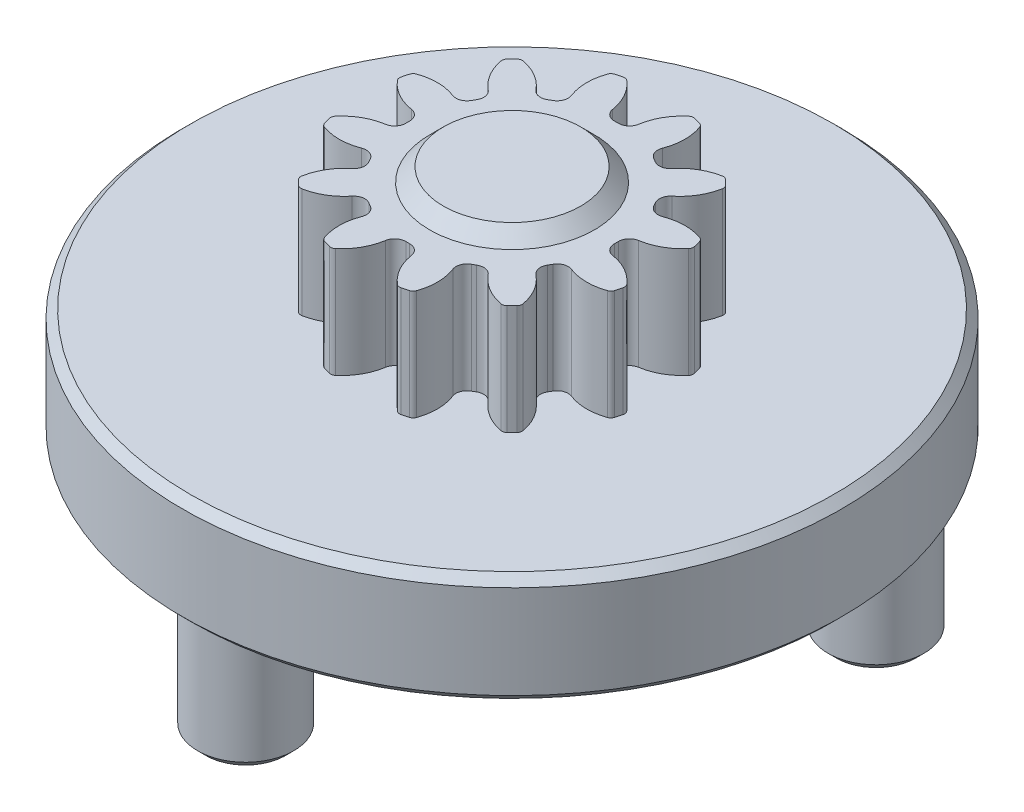
from build123d import *

# Parameters (mm, degrees)
SKETCH1_R            = 5.5
BOSS_EXTRUDE1_DEPTH  = 4
CUT_EXTRUDE1_DEPTH   = 4
FILLET1_R            = 0.2
FILLET2_R            = 0.4
FILLET1_OF_MIRROR1_R = 0.2
FILLET2_OF_MIRROR1_R = 0.4
CIRPATTERN1_DEPTH    = 4
SKETCH3_R            = 3
BOSS_EXTRUDE2_DEPTH  = 0.5
CHAMFER1_SIZE        = 0.5
SKETCH4_R            = 12
BOSS_EXTRUDE3_DEPTH  = 4
SKETCH5_R            = 1.75
BOSS_EXTRUDE4_DEPTH  = 4.5
CHAMFER2_SIZE        = 0.3
CHAMFER3_SIZE        = 0.3


# Read off the part's stored shape, not the designer's step: CirPattern1
with BuildPart() as part:
    # Sketch1 → Boss-Extrude1 (new body)
    with BuildSketch(Plane(origin=(0, 0, 0), x_dir=(1, 0, 0), z_dir=(0, 1, 0))):
        with Locations(Location((0, 0, 0), (0, 0, 270))):
            Circle(SKETCH1_R)
    extrude(amount=BOSS_EXTRUDE1_DEPTH)

    # Sketch2 → Cut-Extrude1 (cut)
    with BuildSketch(Plane(origin=(0, 4, 0), x_dir=(1, 0, 0), z_dir=(0, 1, 0))):
        with BuildLine():
            Line((0, 3.799), (0, 7.477315916))
            Line((0, 7.477315916), (-1.717756705, 5.644784223))
            ThreePointArc((-1.717756705, 5.644784223), (-0.778860554, 4.915006115), (-0.449816676, 3.772275965))
            ThreePointArc((-0.449816676, 3.772275965), (-0.225304913, 3.792313106), (0, 3.799))
        make_face()
    cut_extrude1 = extrude(amount=-CUT_EXTRUDE1_DEPTH, mode=Mode.SUBTRACT)

    # Fillet1
    fillet1_edges = [part.edges().sort_by_distance(p)[0] for p in [
        (-1.205722077, 2, -5.366212284),
    ]]
    fillet(fillet1_edges, radius=FILLET1_R)

    # Fillet2
    fillet2_edges = [part.edges().sort_by_distance(p)[0] for p in [
        (-0.449816676, 2, -3.772275965),
    ]]
    fillet(fillet2_edges, radius=FILLET2_R)

    # Mirror1: Cut-Extrude1 across plane
    add(cut_extrude1.mirror(Plane.ZY), mode=Mode.SUBTRACT)

    # Fillet1 of Mirror1
    fillet1_of_mirror1_edges = [part.edges().sort_by_distance(p)[0] for p in [
        (1.205722077, 2, -5.366212284),
    ]]
    fillet(fillet1_of_mirror1_edges, radius=FILLET1_OF_MIRROR1_R)

    # Fillet2 of Mirror1
    fillet2_of_mirror1_edges = [part.edges().sort_by_distance(p)[0] for p in [
        (0.449816676, 2, -3.772275965),
    ]]
    fillet(fillet2_of_mirror1_edges, radius=FILLET2_OF_MIRROR1_R)

    # CirPattern1 outline → CirPattern1 (cut)
    with BuildSketch(Plane(origin=(0, 0, 0), x_dir=(1, 0, 0), z_dir=(0, 1, 0))):
        with BuildLine():
            ThreePointArc((3.62556251, 4.028637884), (3.71888228, 4.023485264), (3.799671329, 3.976493152))
            ThreePointArc((3.799671329, 3.976493152), (2.75, 4.76313972), (1.543908423, 5.278858473))
            ThreePointArc((1.543908423, 5.278858473), (1.62499931, 5.23238916), (1.676121495, 5.154148179))
            ThreePointArc((1.676121495, 5.154148179), (1.787762124, 4.48460755), (1.659448371, 3.81806133))
            ThreePointArc((1.659448371, 3.81806133), (1.656771541, 3.537498856), (1.839050027, 3.32419855))
            ThreePointArc((1.839050027, 3.32419855), (1.8995, 3.290030509), (1.959315378, 3.254763317))
            ThreePointArc((1.959315378, 3.254763317), (2.235178105, 3.203555671), (2.47681392, 3.34615511))
            ThreePointArc((2.47681392, 3.34615511), (2.989903003, 3.79055119), (3.62556251, 4.028637884))
        make_face()
        with BuildLine():
            ThreePointArc((5.154148179, 1.676121495), (5.23238916, 1.62499931), (5.278858473, 1.543908423))
            ThreePointArc((5.278858473, 1.543908423), (4.763139721, 2.75), (3.976493152, 3.799671329))
            ThreePointArc((3.976493152, 3.799671329), (4.023485264, 3.71888228), (4.028637884, 3.62556251))
            ThreePointArc((4.028637884, 3.62556251), (3.79055119, 2.989903003), (3.34615511, 2.47681392))
            ThreePointArc((3.34615511, 2.47681392), (3.203555671, 2.235178105), (3.254763317, 1.959315378))
            ThreePointArc((3.254763317, 1.959315378), (3.290030509, 1.8995), (3.32419855, 1.839050027))
            ThreePointArc((3.32419855, 1.839050027), (3.537498856, 1.656771541), (3.81806133, 1.659448371))
            ThreePointArc((3.81806133, 1.659448371), (4.48460755, 1.787762124), (5.154148179, 1.676121495))
        make_face()
        with BuildLine():
            ThreePointArc((5.301684005, -1.125510295), (5.34388159, -1.208903897), (5.343579752, -1.302365321))
            ThreePointArc((5.343579752, -1.302365321), (5.5, 0), (5.343579752, 1.302365321))
            ThreePointArc((5.343579752, 1.302365321), (5.34388159, 1.208903897), (5.301684005, 1.125510295))
            ThreePointArc((5.301684005, 1.125510295), (4.777665126, 0.69405636), (4.13626229, 0.47190622))
            ThreePointArc((4.13626229, 0.47190622), (3.891949646, 0.333943185), (3.798365405, 0.069435233))
            ThreePointArc((3.798365405, 0.069435233), (3.799, 0), (3.798365405, -0.069435233))
            ThreePointArc((3.798365405, -0.069435233), (3.891949646, -0.333943185), (4.13626229, -0.47190622))
            ThreePointArc((4.13626229, -0.47190622), (4.777665126, -0.69405636), (5.301684005, -1.125510295))
        make_face()
        with BuildLine():
            ThreePointArc((4.028637884, -3.62556251), (4.023485264, -3.71888228), (3.976493152, -3.799671329))
            ThreePointArc((3.976493152, -3.799671329), (4.763139721, -2.75), (5.278858473, -1.543908423))
            ThreePointArc((5.278858473, -1.543908423), (5.23238916, -1.62499931), (5.154148179, -1.676121495))
            ThreePointArc((5.154148179, -1.676121495), (4.48460755, -1.787762124), (3.81806133, -1.659448371))
            ThreePointArc((3.81806133, -1.659448371), (3.537498856, -1.656771541), (3.32419855, -1.839050027))
            ThreePointArc((3.32419855, -1.839050027), (3.290030509, -1.8995), (3.254763317, -1.959315378))
            ThreePointArc((3.254763317, -1.959315378), (3.203555671, -2.235178105), (3.34615511, -2.47681392))
            ThreePointArc((3.34615511, -2.47681392), (3.79055119, -2.989903003), (4.028637884, -3.62556251))
        make_face()
        with BuildLine():
            ThreePointArc((1.676121495, -5.154148179), (1.62499931, -5.23238916), (1.543908423, -5.278858473))
            ThreePointArc((1.543908423, -5.278858473), (2.75, -4.763139721), (3.799671329, -3.976493152))
            ThreePointArc((3.799671329, -3.976493152), (3.71888228, -4.023485264), (3.62556251, -4.028637884))
            ThreePointArc((3.62556251, -4.028637884), (2.989903003, -3.79055119), (2.47681392, -3.34615511))
            ThreePointArc((2.47681392, -3.34615511), (2.235178105, -3.203555671), (1.959315378, -3.254763317))
            ThreePointArc((1.959315378, -3.254763317), (1.8995, -3.290030509), (1.839050027, -3.32419855))
            ThreePointArc((1.839050027, -3.32419855), (1.656771541, -3.537498856), (1.659448371, -3.81806133))
            ThreePointArc((1.659448371, -3.81806133), (1.787762124, -4.48460755), (1.676121495, -5.154148179))
        make_face()
        with BuildLine():
            ThreePointArc((-1.125510295, -5.301684005), (-1.208903897, -5.34388159), (-1.302365321, -5.343579752))
            ThreePointArc((-1.302365321, -5.343579752), (0, -5.5), (1.302365321, -5.343579752))
            ThreePointArc((1.302365321, -5.343579752), (1.208903897, -5.34388159), (1.125510295, -5.301684005))
            ThreePointArc((1.125510295, -5.301684005), (0.69405636, -4.777665126), (0.47190622, -4.13626229))
            ThreePointArc((0.47190622, -4.13626229), (0.333943185, -3.891949646), (0.069435233, -3.798365405))
            ThreePointArc((0.069435233, -3.798365405), (0, -3.799), (-0.069435233, -3.798365405))
            ThreePointArc((-0.069435233, -3.798365405), (-0.333943185, -3.891949646), (-0.47190622, -4.13626229))
            ThreePointArc((-0.47190622, -4.13626229), (-0.69405636, -4.777665126), (-1.125510295, -5.301684005))
        make_face()
        with BuildLine():
            ThreePointArc((-3.62556251, -4.028637884), (-3.71888228, -4.023485264), (-3.799671329, -3.976493152))
            ThreePointArc((-3.799671329, -3.976493152), (-2.75, -4.763139721), (-1.543908423, -5.278858473))
            ThreePointArc((-1.543908423, -5.278858473), (-1.62499931, -5.23238916), (-1.676121495, -5.154148179))
            ThreePointArc((-1.676121495, -5.154148179), (-1.787762124, -4.48460755), (-1.659448371, -3.81806133))
            ThreePointArc((-1.659448371, -3.81806133), (-1.656771541, -3.537498856), (-1.839050027, -3.32419855))
            ThreePointArc((-1.839050027, -3.32419855), (-1.8995, -3.290030509), (-1.959315378, -3.254763317))
            ThreePointArc((-1.959315378, -3.254763317), (-2.235178105, -3.203555671), (-2.47681392, -3.34615511))
            ThreePointArc((-2.47681392, -3.34615511), (-2.989903003, -3.79055119), (-3.62556251, -4.028637884))
        make_face()
        with BuildLine():
            ThreePointArc((-5.154148179, -1.676121495), (-5.23238916, -1.62499931), (-5.278858473, -1.543908423))
            ThreePointArc((-5.278858473, -1.543908423), (-4.763139721, -2.75), (-3.976493152, -3.799671329))
            ThreePointArc((-3.976493152, -3.799671329), (-4.023485264, -3.71888228), (-4.028637884, -3.62556251))
            ThreePointArc((-4.028637884, -3.62556251), (-3.79055119, -2.989903003), (-3.34615511, -2.47681392))
            ThreePointArc((-3.34615511, -2.47681392), (-3.203555671, -2.235178105), (-3.254763317, -1.959315378))
            ThreePointArc((-3.254763317, -1.959315378), (-3.290030509, -1.8995), (-3.32419855, -1.839050027))
            ThreePointArc((-3.32419855, -1.839050027), (-3.537498856, -1.656771541), (-3.81806133, -1.659448371))
            ThreePointArc((-3.81806133, -1.659448371), (-4.48460755, -1.787762124), (-5.154148179, -1.676121495))
        make_face()
        with BuildLine():
            ThreePointArc((-5.301684005, 1.125510295), (-5.34388159, 1.208903897), (-5.343579752, 1.302365321))
            ThreePointArc((-5.343579752, 1.302365321), (-5.5, 0), (-5.343579752, -1.302365321))
            ThreePointArc((-5.343579752, -1.302365321), (-5.34388159, -1.208903897), (-5.301684005, -1.125510295))
            ThreePointArc((-5.301684005, -1.125510295), (-4.777665126, -0.69405636), (-4.13626229, -0.47190622))
            ThreePointArc((-4.13626229, -0.47190622), (-3.891949646, -0.333943185), (-3.798365405, -0.069435233))
            ThreePointArc((-3.798365405, -0.069435233), (-3.799, 0), (-3.798365405, 0.069435233))
            ThreePointArc((-3.798365405, 0.069435233), (-3.891949646, 0.333943185), (-4.13626229, 0.47190622))
            ThreePointArc((-4.13626229, 0.47190622), (-4.777665126, 0.69405636), (-5.301684005, 1.125510295))
        make_face()
        with BuildLine():
            ThreePointArc((-4.028637884, 3.62556251), (-4.023485264, 3.71888228), (-3.976493152, 3.799671329))
            ThreePointArc((-3.976493152, 3.799671329), (-4.763139721, 2.75), (-5.278858473, 1.543908423))
            ThreePointArc((-5.278858473, 1.543908423), (-5.23238916, 1.62499931), (-5.154148179, 1.676121495))
            ThreePointArc((-5.154148179, 1.676121495), (-4.48460755, 1.787762124), (-3.81806133, 1.659448371))
            ThreePointArc((-3.81806133, 1.659448371), (-3.537498856, 1.656771541), (-3.32419855, 1.839050027))
            ThreePointArc((-3.32419855, 1.839050027), (-3.290030509, 1.8995), (-3.254763317, 1.959315378))
            ThreePointArc((-3.254763317, 1.959315378), (-3.203555671, 2.235178105), (-3.34615511, 2.47681392))
            ThreePointArc((-3.34615511, 2.47681392), (-3.79055119, 2.989903003), (-4.028637884, 3.62556251))
        make_face()
        with BuildLine():
            ThreePointArc((-1.959315378, 3.254763317), (-1.8995, 3.290030509), (-1.839050027, 3.32419855))
            ThreePointArc((-1.839050027, 3.32419855), (-1.656771541, 3.537498856), (-1.659448371, 3.81806133))
            ThreePointArc((-1.659448371, 3.81806133), (-1.787762124, 4.48460755), (-1.676121495, 5.154148179))
            ThreePointArc((-1.676121495, 5.154148179), (-1.62499931, 5.23238916), (-1.543908423, 5.278858473))
            ThreePointArc((-1.543908423, 5.278858473), (-2.75, 4.76313972), (-3.799671329, 3.976493152))
            ThreePointArc((-3.799671329, 3.976493152), (-3.71888228, 4.023485264), (-3.62556251, 4.028637884))
            ThreePointArc((-3.62556251, 4.028637884), (-2.989903003, 3.79055119), (-2.47681392, 3.34615511))
            ThreePointArc((-2.47681392, 3.34615511), (-2.235178105, 3.203555671), (-1.959315378, 3.254763317))
        make_face()
    extrude(amount=CIRPATTERN1_DEPTH, mode=Mode.SUBTRACT)

    # Sketch3 → Boss-Extrude2 (add)
    with BuildSketch(Plane(origin=(0, 4, 0), x_dir=(1, 0, 0), z_dir=(0, 1, 0))):
        with Locations(Location((0, 0, 0), (0, 0, 270))):
            Circle(SKETCH3_R)
    extrude(amount=BOSS_EXTRUDE2_DEPTH)

    # Chamfer1
    chamfer1_edges = [part.edges().sort_by_distance(p)[0] for p in [
        (0, 4.5, -3),
    ]]
    chamfer(chamfer1_edges, length=CHAMFER1_SIZE - 0.0001)  # a hair under: the kernel refuses the full size

    # Sketch4 → Boss-Extrude3 (add)
    with BuildSketch(Plane.XZ):
        with Locations(Location((0, 0, 0), (0, 0, 270))):
            Circle(SKETCH4_R)
    extrude(amount=BOSS_EXTRUDE3_DEPTH)

    # Sketch5 → Boss-Extrude4 (add)
    with BuildSketch(Plane.XZ.offset(4)):
        with Locations(Location((0, 9.7, 0), (0, 0, 270))):
            Circle(SKETCH5_R)
        with Locations(Location((-8.400446417, -4.85, 0), (0, 0, 270))):
            Circle(SKETCH5_R)
        with Locations(Location((8.400446417, -4.85, 0), (0, 0, 270))):
            Circle(SKETCH5_R)
    extrude(amount=BOSS_EXTRUDE4_DEPTH)

    # Chamfer2
    chamfer2_edges = [part.edges().sort_by_distance(p)[0] for p in [
        (0, -8.5, 11.45),
        (-8.400446417, -8.5, -3.1),
        (8.400446417, -8.5, -3.1),
    ]]
    chamfer(chamfer2_edges, length=CHAMFER2_SIZE)

    # Chamfer3
    chamfer3_edges = [part.edges().sort_by_distance(p)[0] for p in [
        (0, 0, 12),
        (0, -4, 12),
    ]]
    chamfer(chamfer3_edges, length=CHAMFER3_SIZE)


solid = part.part
